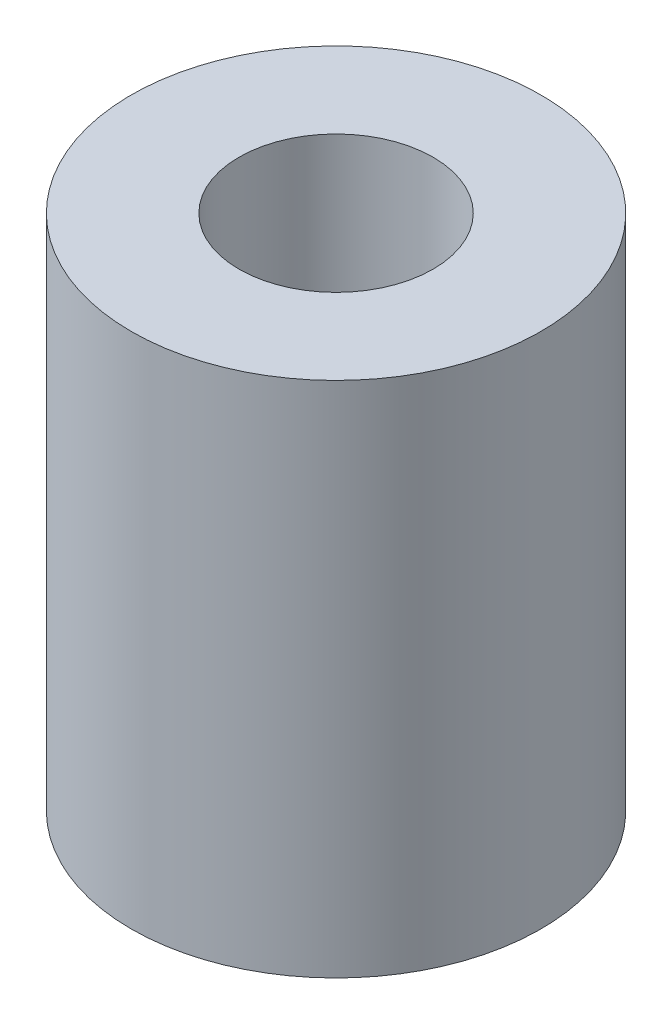
from build123d import *

# Parameters (mm, degrees)
SKETCH1_R           = 9.5
SKETCH1_R_2         = 3
BOSS_EXTRUDE1_DEPTH = 8
SKETCH2_R           = 9.5
SKETCH2_R_2         = 4.5
BOSS_EXTRUDE2_DEPTH = 16


with BuildPart() as part:
    # Sketch1 → Boss-Extrude1 (new body)
    with BuildSketch(Plane(origin=(0, 0, 0), x_dir=(1, 0, 0), z_dir=(0, 1, 0))):
        Circle(SKETCH1_R)
        Circle(SKETCH1_R_2, mode=Mode.SUBTRACT)
    extrude(amount=BOSS_EXTRUDE1_DEPTH)

    # Sketch2 → Boss-Extrude2 (add)
    with BuildSketch(Plane(origin=(0, 8, 0), x_dir=(1, 0, 0), z_dir=(0, 1, 0))):
        Circle(SKETCH2_R)
        Circle(SKETCH2_R_2, mode=Mode.SUBTRACT)
    extrude(amount=BOSS_EXTRUDE2_DEPTH)


solid = part.part
